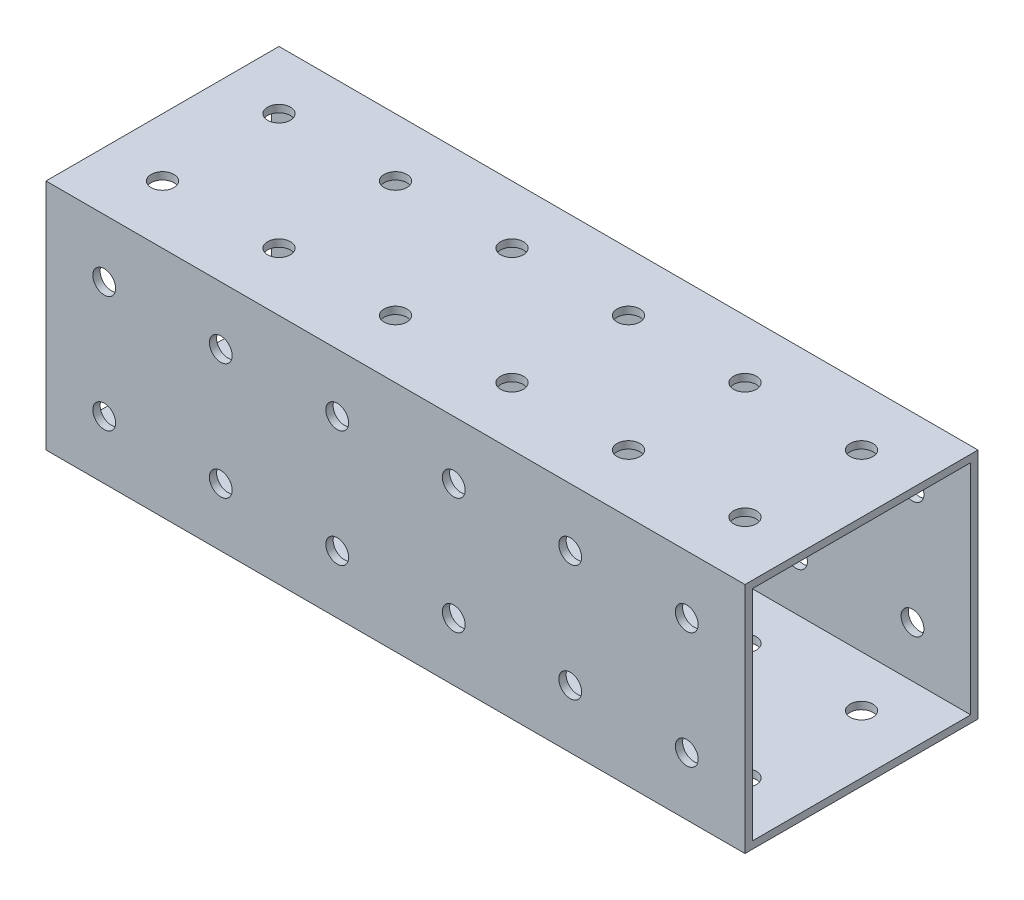
from build123d import *

# Parameters (mm, degrees)
SKETCH1_W           = 50.8
SKETCH1_H           = 50.8
BOSS_EXTRUDE1_DEPTH = 152.4
SHELL1_T            = -1.5875
SKETCH2_R           = 2.4892
CUT_EXTRUDE1_DEPTH  = 169.48453935
SKETCH3_R           = 2.4892
CUT_EXTRUDE2_DEPTH  = 169.48453935
LPATTERN1_COUNT     = 6
LPATTERN1_PITCH     = 25.4


with BuildPart() as part:
    # Sketch1 → Boss-Extrude1 (new body)
    with BuildSketch(Plane(origin=(0, 0, 0), x_dir=(0, 0, -1), z_dir=(1, 0, 0))):
        with Locations((25.4, 25.4)):
            Rectangle(SKETCH1_W, SKETCH1_H)
    extrude(amount=BOSS_EXTRUDE1_DEPTH)

    # Shell1
    shell1_openings = [part.faces().sort_by_distance(p)[0] for p in [
        (0, 25.4, -25.4),
        (152.4, 25.4, -25.4),
    ]]
    offset(amount=SHELL1_T, openings=shell1_openings, kind=Kind.INTERSECTION)

    # Sketch2 → Cut-Extrude1 (cut, through all)
    with BuildSketch(Plane(origin=(0, 0, -50.8), x_dir=(-1, 0, 0), z_dir=(0, 0, -1))):
        with Locations((-12.7, 12.7)):
            Circle(SKETCH2_R)
        with Locations((-12.7, 38.1)):
            Circle(SKETCH2_R)
    cut_extrude1 = extrude(amount=-CUT_EXTRUDE1_DEPTH, mode=Mode.SUBTRACT)

    # Sketch3 → Cut-Extrude2 (cut, through all)
    with BuildSketch(Plane(origin=(0, 50.8, 0), x_dir=(1, 0, 0), z_dir=(0, 1, 0))):
        with Locations((12.7, 12.7)):
            Circle(SKETCH3_R)
        with Locations((12.7, 38.1)):
            Circle(SKETCH3_R)
    cut_extrude2 = extrude(amount=-CUT_EXTRUDE2_DEPTH, mode=Mode.SUBTRACT)

    # LPattern1: Cut-Extrude1, Cut-Extrude2 ×6
    with Locations(*[(i * LPATTERN1_PITCH, 0, 0) for i in range(1, LPATTERN1_COUNT)]):
        add(cut_extrude1, mode=Mode.SUBTRACT)
        add(cut_extrude2, mode=Mode.SUBTRACT)


solid = part.part
